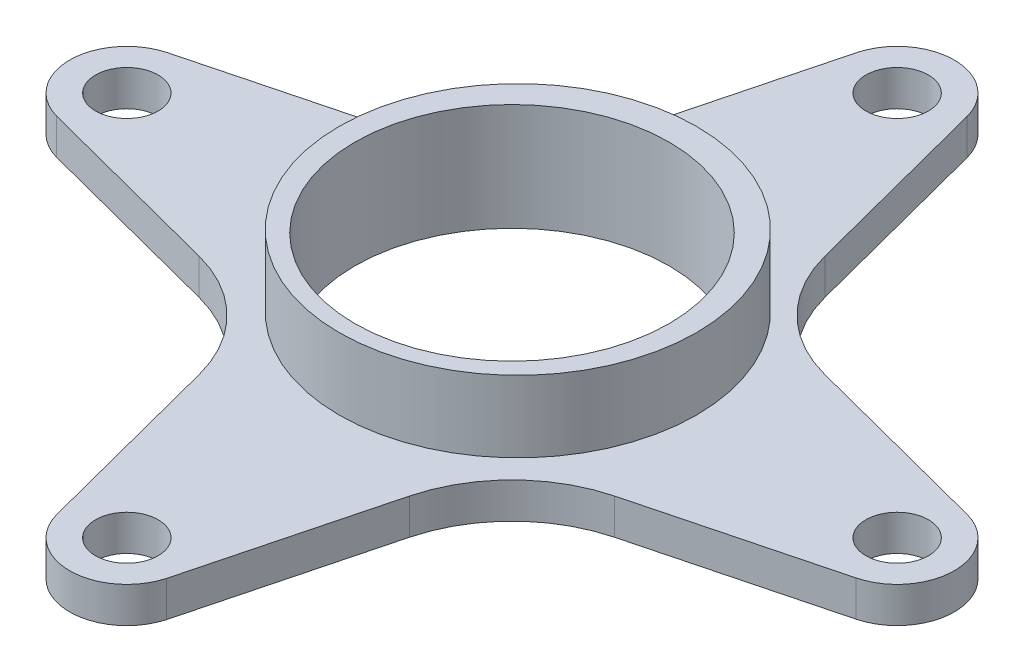
from build123d import *

# Parameters (mm, degrees)
SKETCH1_R           = 5.55625
SKETCH1_R_2         = 27.94
BOSS_EXTRUDE1_DEPTH = 6.35
SKETCH2_R           = 31.75
SKETCH2_R_2         = 27.94
BOSS_EXTRUDE2_DEPTH = 12.7


with BuildPart() as part:
    # Sketch1 → Boss-Extrude1 (new body)
    with BuildSketch(Plane(origin=(0, 0, 0), x_dir=(1, 0, 0), z_dir=(0, 1, 0))):
        with BuildLine():
            ThreePointArc((-18.697333242, 36.892640474), (-25.320558446, 25.320679007), (-36.892798129, 18.697939919))
            Line((-36.892798129, 18.697939919), (-71.007523203, 9.833451426))
            ThreePointArc((-71.007523203, 9.833451426), (-78.611836011, 0.103683747), (-71.207683119, -9.7792547))
            Line((-71.207683119, -9.7792547), (-36.892640474, -18.697333242))
            ThreePointArc((-36.892640474, -18.697333242), (-25.320679007, -25.320558446), (-18.697939919, -36.892798129))
            Line((-18.697939919, -36.892798129), (-9.833451426, -71.007523203))
            ThreePointArc((-9.833451426, -71.007523203), (-0.103683747, -78.611836011), (9.7792547, -71.207683119))
            Line((9.7792547, -71.207683119), (18.697333242, -36.892640474))
            ThreePointArc((18.697333242, -36.892640474), (25.320558446, -25.320679007), (36.892798129, -18.697939919))
            Line((36.892798129, -18.697939919), (71.007523203, -9.833451426))
            ThreePointArc((71.007523203, -9.833451426), (78.611836011, -0.103683747), (71.207683119, 9.7792547))
            Line((71.207683119, 9.7792547), (36.892640474, 18.697333242))
            ThreePointArc((36.892640474, 18.697333242), (25.320679007, 25.320558446), (18.697939919, 36.892798129))
            Line((18.697939919, 36.892798129), (9.833451426, 71.007523203))
            ThreePointArc((9.833451426, 71.007523203), (0.103683747, 78.611836011), (-9.7792547, 71.207683119))
            Line((-9.7792547, 71.207683119), (-18.697333242, 36.892640474))
        make_face()
        with Locations((0, 68.452365076)):
            Circle(SKETCH1_R, mode=Mode.SUBTRACT)
        with Locations((68.452365076, 0)):
            Circle(SKETCH1_R, mode=Mode.SUBTRACT)
        with Locations((0, -68.452365076)):
            Circle(SKETCH1_R, mode=Mode.SUBTRACT)
        with Locations((-68.452365076, 0)):
            Circle(SKETCH1_R, mode=Mode.SUBTRACT)
        Circle(SKETCH1_R_2, mode=Mode.SUBTRACT)
    extrude(amount=BOSS_EXTRUDE1_DEPTH)

    # Sketch2 → Boss-Extrude2 (add)
    with BuildSketch(Plane(origin=(0, 6.35, 0), x_dir=(1, 0, 0), z_dir=(0, 1, 0))):
        with Locations((0, 1.038430884)):
            Circle(SKETCH2_R)
        Circle(SKETCH2_R_2, mode=Mode.SUBTRACT)
    extrude(amount=BOSS_EXTRUDE2_DEPTH)


solid = part.part
